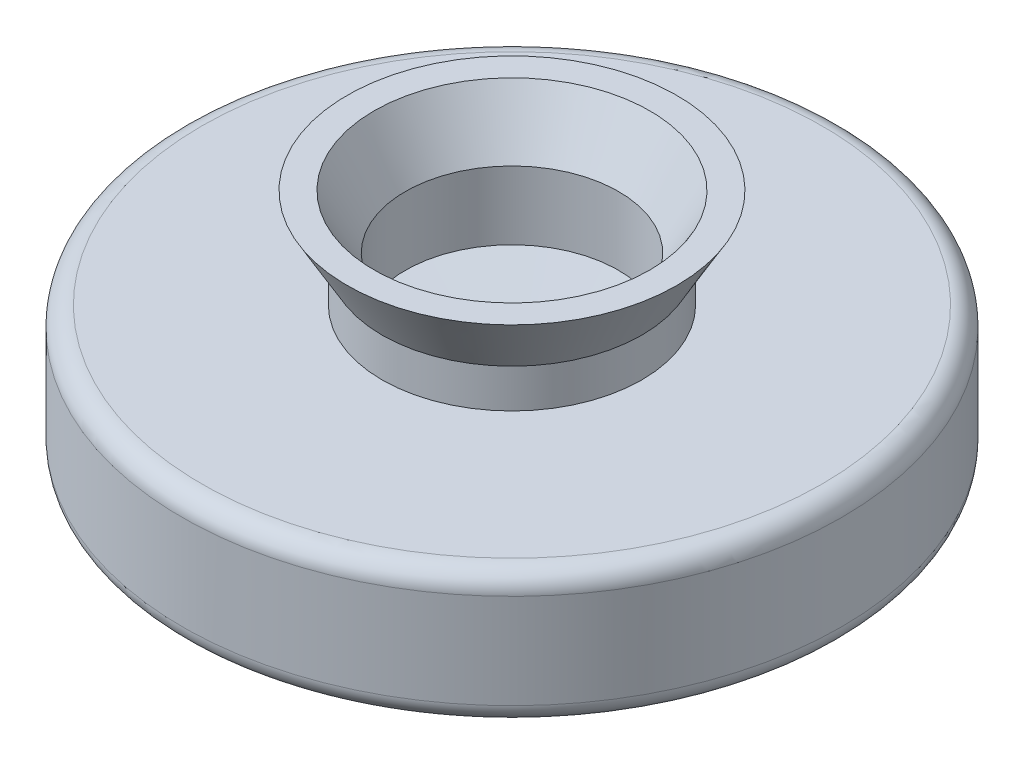
from build123d import *

# Parameters (mm, degrees)
FILLET1_R = 5


with BuildPart() as part:
    # Sketch1 → Revolve2 (revolve)
    with BuildSketch(Plane.XY):
        with BuildLine():
            Line((4.2164, -22.411542732), (4.2164, -28.411542732))
            Line((4.2164, -28.411542732), (85, -28.411542732))
            Line((85, -28.411542732), (85, 6))
            Line((85, 6), (33.5, 6))
            Line((33.5, 6), (33.5, 16))
            Line((33.5, 16), (42.5, 31.588457268))
            Line((42.5, 31.588457268), (35.57179677, 31.588457268))
            Line((35.57179677, 31.588457268), (27.5, 17.607695155))
            Line((27.5, 17.607695155), (27.5, 0))
            Line((27.5, 0), (79, 0))
            Line((79, 0), (79, -7.282040853))
            ThreePointArc((79, -7.282040853), (76.343225094, -14.070048308), (69.784590957, -17.25121419))
            Line((69.784590957, -17.25121419), (4.2164, -22.411542732))
        make_face()
    revolve(axis=Axis((1e-09, -1021.213113582, 0), (0, 1, 0)))

    # Fillet1
    fillet1_edges = [part.edges().sort_by_distance(p)[0] for p in [
        (-84.999999999, 6, 0),
        (-84.999999999, -28.411542732, 0),
    ]]
    fillet(fillet1_edges, radius=FILLET1_R)


solid = part.part
